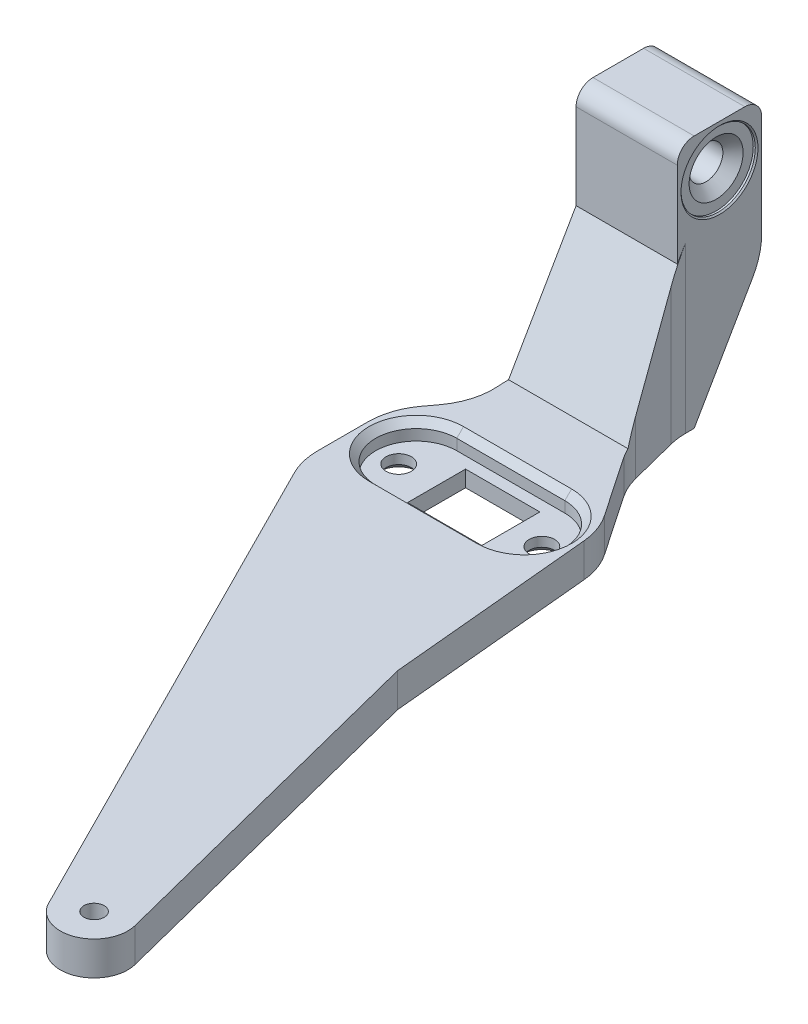
from build123d import *

# Parameters (mm, degrees)
SKETCH1_R           = 6.35
SKETCH1_R_2         = 1.905
BOSS_EXTRUDE1_DEPTH = 6.35
FILLET2_R           = 25.4
SKETCH2_W           = 19.03095
SKETCH2_H           = 15.875
BOSS_EXTRUDE2_DEPTH = 41.275
SKETCH3_R           = 3.175
CUT_EXTRUDE1_DEPTH  = 176.899083324
SKETCH4_R           = 6.985
CUT_EXTRUDE2_DEPTH  = 0.635
CHAMFER1_SIZE       = 0.254
CHAMFER2_SIZE       = 1.905
FILLET3_R           = 3.175
CHAMFER3_SIZE       = 12.7
CHAMFER3_SIZE2      = 21.997045256
SKETCH6_R           = 1.905
BOSS_EXTRUDE3_DEPTH = 6.35
CUT_EXTRUDE3_DEPTH  = 6.35
FILLET4_R           = 6.35
CHAMFER5_SIZE       = 12.7
CHAMFER5_SIZE2      = 21.997045256
FILLET5_R           = 12.7
SKETCH7_R           = 1.905
BOSS_EXTRUDE4_DEPTH = 6.35
CUT_EXTRUDE4_DEPTH  = 170.362801463
CUT_EXTRUDE5_DEPTH  = 3.302
SKETCH10_3_R        = 2.38125
SKETCH10_3_W        = 12.7
SKETCH10_3_H        = 10.922
CUT_EXTRUDE6_DEPTH  = 170.362801463
CHAMFER6_SIZE       = 1.27
CHAMFER7_SIZE       = 1.27
CUT_EXTRUDE7_DEPTH  = 183.63914045
FILLET6_R           = 12.7


with BuildPart() as part:
    # Sketch1 → Boss-Extrude1 (new body)
    # profile 1 of 2: a face of its own
    with BuildSketch(Plane(origin=(0, 0, 0), x_dir=(1, 0, 0), z_dir=(0, 1, 0))):
        with BuildLine():
            Line((0, -15.875), (-34.748352364, -152.581941075))
            ThreePointArc((-34.748352364, -152.581941075), (-27.805798775, -147.845364348), (-22.24405, -154.14625))
            ThreePointArc((-22.24405, -154.14625), (-22.363673933, -155.372999389), (-22.718038681, -156.553528751))
            Line((-22.718038681, -156.553528751), (3.697461152, -92.075))
            Line((3.697461152, -92.075), (19.03095, -31.75))
            Line((19.03095, -31.75), (19.03095, 0))
            Line((19.03095, 0), (0, 0))
            Line((0, 0), (0, -15.875))
        make_face()
    # profile 2 of 2: a face of its own
    with BuildSketch(Plane(origin=(0, 0, 0), x_dir=(1, 0, 0), z_dir=(0, 1, 0))):
        with Locations((-28.59405, -154.14625)):
            Circle(SKETCH1_R)
        with Locations(Location((-28.59405, -154.14625, 0), (0, 0, 270))):
            Circle(SKETCH1_R_2, mode=Mode.SUBTRACT)
    extrude(amount=BOSS_EXTRUDE1_DEPTH)

    # Fillet2
    fillet2_edges = [part.edges().sort_by_distance(p)[0] for p in [
        (19.03095, 3.175, 31.75),
        (3.697461152, 3.175, 92.075),
    ]]
    fillet(fillet2_edges, radius=FILLET2_R)

    # Sketch2 → Boss-Extrude2 (add)
    with BuildSketch(Plane(origin=(0, 6.35, 0), x_dir=(1, 0, 0), z_dir=(0, 1, 0))):
        with Locations((9.515475, -7.9375)):
            Rectangle(SKETCH2_W, SKETCH2_H)
    extrude(amount=BOSS_EXTRUDE2_DEPTH)

    # Sketch3 → Cut-Extrude1 (cut, through all)
    with BuildSketch(Plane(origin=(19.03095, 0, 0), x_dir=(0, 0, -1), z_dir=(1, 0, 0))):
        with Locations((-7.9375, 39.6875)):
            Circle(SKETCH3_R)
    extrude(amount=-CUT_EXTRUDE1_DEPTH, mode=Mode.SUBTRACT)

    # Sketch4 → Cut-Extrude2 (cut)
    with BuildSketch(Plane(origin=(19.03095, 0, 0), x_dir=(0, 0, -1), z_dir=(1, 0, 0))):
        with Locations((-7.9375, 39.6875)):
            Circle(SKETCH4_R)
    cut_extrude2 = extrude(amount=-CUT_EXTRUDE2_DEPTH, mode=Mode.SUBTRACT)

    # Mirror1: Cut-Extrude2 across plane
    add(cut_extrude2.mirror(Plane(origin=(9.515475, 0, 0), x_dir=(0, 0, 1), z_dir=(1, 0, 0))), mode=Mode.SUBTRACT)

    # Chamfer1
    chamfer1_edges = [part.edges().sort_by_distance(p)[0] for p in [
        (19.03095, 39.6875, 14.9225),
        (0, 39.6875, 14.9225),
    ]]
    chamfer(chamfer1_edges, length=CHAMFER1_SIZE)

    # Chamfer2
    chamfer2_edges = [part.edges().sort_by_distance(p)[0] for p in [
        (18.39595, 39.6875, 11.1125),
        (0.635, 39.6875, 11.1125),
    ]]
    chamfer(chamfer2_edges, length=CHAMFER2_SIZE)

    # Fillet3
    fillet3_edges = [part.edges().sort_by_distance(p)[0] for p in [
        (9.515475, 47.625, 0),
        (9.515475, 47.625, 15.875),
    ]]
    fillet(fillet3_edges, radius=FILLET3_R)

    # Chamfer3
    chamfer3_edges = [part.edges().sort_by_distance(p)[0] for p in [
        (9.515475, 6.35, 15.875),
    ]]
    chamfer3_side = [part.faces().sort_by_distance(p)[0] for p in [
        (-6.326800104, 6.35, 82.033556201),
    ]]
    chamfer(chamfer3_edges, length=CHAMFER3_SIZE, length2=CHAMFER3_SIZE2, reference=chamfer3_side[0])

    # Sketch6 → Boss-Extrude3 (add)
    # profile 1 of 2: a face of its own
    with BuildSketch(Plane(origin=(0, 6.35, 0), x_dir=(1, 0, 0), z_dir=(0, 1, 0))):
        with BuildLine():
            Line((-8.255, -44.45), (-6.925228458, -43.120228458))
            Line((-6.925228458, -43.120228458), (-3.228102915, -28.575))
            Line((-3.228102915, -28.575), (-13.99495746, -44.45))
            Line((-13.99495746, -44.45), (-15.073361931, -55.976593532))
            ThreePointArc((-15.073361931, -55.976593532), (-20.292390061, -61.638490142), (-16.214172451, -68.17021801))
            Line((-16.214172451, -68.17021801), (-17.91597118, -86.36))
            Line((-17.91597118, -86.36), (-8.255, -48.351814634))
            Line((-8.255, -48.351814634), (-8.255, -44.45))
        make_face()
        with Locations(Location((-13.97, -62.23, 0), (0, 0, 270))):
            Circle(SKETCH6_R, mode=Mode.SUBTRACT)
    # profile 2 of 2: a face of its own
    with BuildSketch(Plane(origin=(0, 6.35, 0), x_dir=(1, 0, 0), z_dir=(0, 1, 0))):
        with BuildLine():
            Line((18.248159602, -34.82965338), (4.135908565, -90.350060527))
            ThreePointArc((4.135908565, -90.350060527), (3.638321539, -92.055476142), (3.022744588, -93.721939549))
            Line((3.022744588, -93.721939549), (-22.718038594, -156.553528537))
            Line((-22.718038594, -156.553528537), (25.4, -86.36))
            Line((25.4, -86.36), (25.4, -68.58))
            ThreePointArc((25.4, -68.58), (31.75, -62.23), (25.4, -55.88))
            Line((25.4, -55.88), (25.4, -44.45))
            Line((25.4, -44.45), (18.248159602, -34.82965338))
        make_face()
        with Locations(Location((25.4, -62.23, 0), (0, 0, 270))):
            Circle(SKETCH6_R, mode=Mode.SUBTRACT)
    extrude(amount=-BOSS_EXTRUDE3_DEPTH)

    # Sketch6<3> → Cut-Extrude3 (cut)
    with BuildSketch(Plane(origin=(0, 6.35, 0), x_dir=(1, 0, 0), z_dir=(0, 1, 0))):
        Polygon((-1.905, -38.1), (13.335, -38.1), (19.685, -44.45), (19.685, -86.36), (-8.255, -86.36), (-8.255, -44.45), align=None)
    extrude(amount=-CUT_EXTRUDE3_DEPTH, mode=Mode.SUBTRACT)

    # Fillet4
    fillet4_edges = [part.edges().sort_by_distance(p)[0] for p in [
        (25.4, 3.175, 55.88),
        (25.4, 3.175, 68.58),
        (25.4, 3.175, 86.36),
        (-16.214172451, 3.175, 68.17021801),
        (-15.073361931, 3.175, 55.976593532),
    ]]
    fillet(fillet4_edges, radius=FILLET4_R)

    # Chamfer5
    chamfer5_edges = [part.edges().sort_by_distance(p)[0] for p in [
        (9.515475, 0, 0),
    ]]
    chamfer5_side = [part.faces().sort_by_distance(p)[0] for p in [
        (-0.648785112, 0, 121.285485339),
    ]]
    chamfer(chamfer5_edges, length=CHAMFER5_SIZE, length2=CHAMFER5_SIZE2, reference=chamfer5_side[0])

    # Fillet5
    fillet5_edges = [part.edges().sort_by_distance(p)[0] for p in [
        (9.515475, 21.997045256, 0),
    ]]
    fillet(fillet5_edges, radius=FILLET5_R)

    # Sketch7 → Boss-Extrude4 (add)
    with BuildSketch(Plane(origin=(0, 6.35, 0), x_dir=(1, 0, 0), z_dir=(0, 1, 0))):
        with Locations((-13.97, -62.23)):
            Circle(SKETCH7_R)
        with Locations((25.4, -62.23)):
            Circle(SKETCH7_R)
        Polygon((-8.255, -86.36), (19.685, -86.36), (19.685, -44.45), (13.335, -38.1), (-1.905, -38.1), (-8.255, -44.45), align=None)
    extrude(amount=-BOSS_EXTRUDE4_DEPTH)

    # Sketch9 → Cut-Extrude4 (cut, through all)
    with BuildSketch(Plane(origin=(0, 6.35, 0), x_dir=(1, 0, 0), z_dir=(0, 1, 0))):
        with BuildLine():
            Line((-14.727319743, -52.277899988), (-16.560214639, -71.868911554))
            ThreePointArc((-16.560214639, -71.868911554), (-16.917171132, -69.101142904), (-18.42630235, -66.753700848))
            ThreePointArc((-18.42630235, -66.753700848), (-20.292390061, -61.638490142), (-17.509854902, -56.958195065))
            ThreePointArc((-17.509854902, -56.958195065), (-15.591481206, -54.931423346), (-14.727319743, -52.277899988))
        make_face()
        with BuildLine():
            Line((25.4, -73.228522628), (25.4, -51.231477372))
            ThreePointArc((25.4, -51.231477372), (26.250738686, -54.406477372), (28.575, -56.730738686))
            ThreePointArc((28.575, -56.730738686), (31.75, -62.23), (28.575, -67.729261314))
            ThreePointArc((28.575, -67.729261314), (26.250738686, -70.053522628), (25.4, -73.228522628))
        make_face()
    extrude(amount=-CUT_EXTRUDE4_DEPTH, mode=Mode.SUBTRACT)

    # Sketch10 → Cut-Extrude5 (cut)
    with BuildSketch(Plane(origin=(0, 6.35, 0), x_dir=(1, 0, 0), z_dir=(0, 1, 0))):
        with BuildLine():
            Line((-4.685595345, -41.706477372), (15.634404655, -41.706477372))
            ThreePointArc((15.634404655, -41.706477372), (23.254404655, -49.326477372), (15.634404655, -56.946477372))
            Line((15.634404655, -56.946477372), (-4.685595345, -56.946477372))
            ThreePointArc((-4.685595345, -56.946477372), (-12.305595345, -49.326477372), (-4.685595345, -41.706477372))
        make_face()
    extrude(amount=-CUT_EXTRUDE5_DEPTH, mode=Mode.SUBTRACT)

    # Sketch10<3> → Cut-Extrude6 (cut, through all)
    with BuildSketch(Plane(origin=(0, 6.35, 0), x_dir=(1, 0, 0), z_dir=(0, 1, 0))):
        with Locations(Location((-7.987595345, -49.326477372, 0), (0, 0, 270))):
            Circle(SKETCH10_3_R)
        with Locations((5.474404655, -49.326477372)):
            Rectangle(SKETCH10_3_W, SKETCH10_3_H)
        with Locations(Location((18.936404655, -49.326477372, 0), (0, 0, 270))):
            Circle(SKETCH10_3_R)
    extrude(amount=-CUT_EXTRUDE6_DEPTH, mode=Mode.SUBTRACT)

    # Chamfer6
    chamfer6_edges = [part.edges().sort_by_distance(p)[0] for p in [
        (5.474404655, 6.35, 41.706477372),
        (-12.305595345, 6.35, 49.326477372),
        (5.474404655, 6.35, 56.946477372),
        (23.254404655, 6.35, 49.326477372),
        (-0.875595345, 3.048, 49.326477372),
    ]]
    chamfer(chamfer6_edges, length=CHAMFER6_SIZE)

    # Chamfer7
    chamfer7_edges = [part.edges().sort_by_distance(p)[0] for p in [
        (-7.987595345, 0, 46.945227372),
        (18.936404655, 0, 46.945227372),
    ]]
    chamfer(chamfer7_edges, length=CHAMFER7_SIZE)


with BuildPart() as body_2:
    # Mirror2: read off the stored shape, not the designer's step
    # Mirror2: mirrored copy
    add(part.part.mirror(Plane.YZ.offset(19.03095)))

    # Sketch11 → Cut-Extrude7 (cut, through all)
    with BuildSketch(Plane.XZ):
        with BuildLine():
            Line((60.779938594, 156.553528537), (12.6619, 61.137477372))
            Line((12.6619, 61.137477372), (12.6619, 84.392473417))
            ThreePointArc((12.6619, 84.392473417), (12.946388069, 86.271852309), (13.774361424, 87.982834076))
            Line((13.774361424, 87.982834076), (60.779938594, 156.553528537))
        make_face()
    extrude(amount=-CUT_EXTRUDE7_DEPTH, mode=Mode.SUBTRACT)

    # Fillet6
    # the kernel refuses this fillet: 12.7 mm, written as the material it adds along each edge
    with BuildSketch(Plane(origin=(41.290002915, 11.915442624, 28.575), x_dir=(0.5613062559258853, 0, 0.8276081724212639), z_dir=(0, -1, 0))) as fillet6_piece_1_section:
        with BuildLine():
            CenterArc((FILLET6_R * 0.17528953146, -FILLET6_R), FILLET6_R, 90, 19.884681412)
            Line((-FILLET6_R * 0.164838611345, -FILLET6_R * 0.0596209027884), (0, 0))
            Line((0, 0), (FILLET6_R * 0.17528953146, 0))
        make_face()
    fillet6_piece_1 = extrude(amount=11.915442624, mode=Mode.PRIVATE)
    fillet6_piece_1 = split(fillet6_piece_1, bisect_by=Plane(origin=(41.290002915, 10.524081968, 26.165092652), z_dir=(0, -0.49999999999999806, -0.8660254037844398)), keep=Keep.TOP, mode=Mode.PRIVATE)
    add(fillet6_piece_1)
    with BuildSketch(Plane(origin=(41.290002915, 6.35, 28.575), x_dir=(0.5613062559258853, 0, 0.8276081724212639), z_dir=(0, -1, 0))) as fillet6_piece_2_section:
        with BuildLine():
            CenterArc((FILLET6_R * 0.17528953146, -FILLET6_R), FILLET6_R, 90, 19.884681412)
            Line((-FILLET6_R * 0.164838611345, -FILLET6_R * 0.0596209027884), (0, 0))
            Line((0, 0), (FILLET6_R * 0.17528953146, 0))
        make_face()
    fillet6_piece_2 = extrude(amount=11.915442624, mode=Mode.PRIVATE)
    fillet6_piece_2 = split(fillet6_piece_2, bisect_by=Plane(origin=(41.290002915, 6.35, 28.575), z_dir=(0, 0.49999999999999806, 0.8660254037844398)), keep=Keep.TOP, mode=Mode.PRIVATE)
    add(fillet6_piece_2)
    with BuildSketch(Plane(origin=(38.0619, 0, 15.875), x_dir=(0.24634783955161182, 0, 0.9691814803989258), z_dir=(0, 1, 0))) as fillet6_piece_3_section:
        with BuildLine():
            CenterArc((FILLET6_R * 0.125101643502, FILLET6_R), FILLET6_R, 255.73849915, 14.26150085)
            Line((-FILLET6_R * 0.12124619605, FILLET6_R * 0.0308185196011), (0, 0))
            Line((0, 0), (FILLET6_R * 0.125101643502, 0))
        make_face()
    fillet6_piece_3 = extrude(amount=32.319022437, mode=Mode.PRIVATE)
    fillet6_piece_3 = split(fillet6_piece_3, bisect_by=Plane(origin=(38.0619, 7.086761314, 28.149630657), z_dir=(0, -0.49999999999999806, -0.8660254037844398)), keep=Keep.TOP, mode=Mode.PRIVATE)
    add(fillet6_piece_3)
    with BuildSketch(Plane(origin=(60.779938681, 0, 156.553528751), x_dir=(-0.4502803833327004, 0, -0.892887213698212), z_dir=(0, 1, 0))) as fillet6_piece_4:
        with BuildLine():
            CenterArc((0.363846893, 12.7), FILLET6_R, 267.411723266, 2.588279583)
            ThreePointArc((-0.209667177, 0.012956152), (-0.104780009, 0.007345146), (0, 0))
            Line((0, 0), (0.363847525, 0))
        make_face()
    extrude(amount=6.35)
    with BuildSketch(Plane(origin=(19.813740398, 0, 34.82965338), x_dir=(-0.1625178407980129, 0, -0.9867056052452279), z_dir=(0, 1, 0))) as fillet6_piece_5:
        with BuildLine():
            CenterArc((5.433283049, 12.653425521), FILLET6_R, 224.019529776, 41.072040405)
            Line((-3.699324772, 3.828150773), (0, 0))
            ThreePointArc((0, 0), (2.17331322, 0.093148958), (4.34662644, 0))
        make_face()
    extrude(amount=6.35)
    # the kernel refuses this fillet: 12.7 mm, written as the material it takes off along each edge
    with BuildSketch(Plane(origin=(12.6619, 16.858731076, 44.45), x_dir=(0.5966087190088384, 0, -0.8025322650228044), z_dir=(0, -1, 0))) as fillet6_2_piece_1:
        with BuildLine():
            CenterArc((FILLET6_R * 0.33098365593, FILLET6_R), FILLET6_R, 233.372600808, 36.627399192)
            Line((-FILLET6_R * 0.265625063079, FILLET6_R * 0.197467734977), (0, 0))
            Line((0, 0), (FILLET6_R * 0.33098365593, 0))
        make_face()
    extrude(amount=27.367462152, mode=Mode.SUBTRACT)
    with BuildSketch(Plane(origin=(52.05685746, 14.502388088, 44.45), x_dir=(0.0931511588181929, 0, 0.9956519781584466), z_dir=(0, -1, 0))) as fillet6_2_piece_2:
        with BuildLine():
            CenterArc((FILLET6_R * 0.25676812876, FILLET6_R), FILLET6_R, 241.198734849, 28.801265151)
            Line((-FILLET6_R * 0.225004894996, FILLET6_R * 0.123703957797), (0, 0))
            Line((0, 0), (FILLET6_R * 0.25676812876, 0))
        make_face()
    extrude(amount=22.654776176, mode=Mode.SUBTRACT)
    with BuildSketch(Plane(origin=(12.6619, -7.55269709, 61.137477372), x_dir=(0, 0, -1), z_dir=(0, 1, 0))) as fillet6_2_piece_3:
        with BuildLine():
            CenterArc((FILLET6_R * 0.237880223292, -FILLET6_R), FILLET6_R, 90, 26.761677325)
            Line((-FILLET6_R * 0.212400204442, -FILLET6_R * 0.107112808693), (0, 0))
            Line((0, 0), (FILLET6_R * 0.237880223292, 0))
        make_face()
    extrude(amount=21.455394179, mode=Mode.SUBTRACT)


solid = body_2.part
